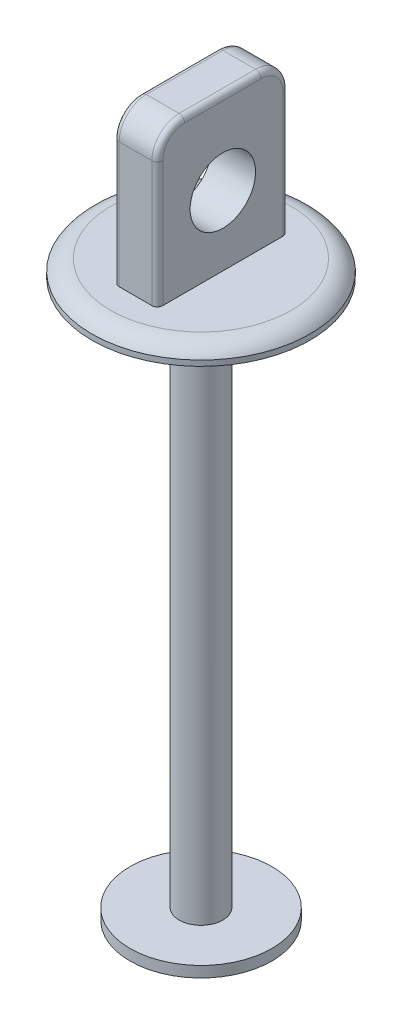
from build123d import *

# Parameters (mm, degrees)
SKETCH1_R               = 13
BOSS_EXTRUDE1_DEPTH     = 2
SKETCH2_R               = 4
BOSS_EXTRUDE2_DEPTH     = 100
SKETCH3_R               = 20
BOSS_EXTRUDE3_DEPTH     = 1
SKETCH4_R               = 17
BOSS_EXTRUDE4_DEPTH     = 1
SKETCH5_W               = 8
SKETCH5_H               = 24
BOSS_EXTRUDE5_DEPTH     = 30
SKETCH6_R               = 20
BOSS_EXTRUDE6_DEPTH     = 2
FILLET1_R               = 4
FILLET3_R               = 5
FILLET4_R               = 1
CUT_EXTRUDE1_DEPTH      = 136.97426227
CUT_EXTRUDE1_DEPTH_BACK = 136.97426227
SKETCH11_R              = 6


with BuildPart() as part:
    # Sketch1 → Boss-Extrude1 (new body)
    with BuildSketch(Plane(origin=(0, 0, 0), x_dir=(1, 0, 0), z_dir=(0, 1, 0))):
        with Locations(Location((0, 0, 0), (0, 0, 270))):
            Circle(SKETCH1_R)
    extrude(amount=BOSS_EXTRUDE1_DEPTH)

    # Sketch2 → Boss-Extrude2 (add)
    with BuildSketch(Plane(origin=(0, 2, 0), x_dir=(1, 0, 0), z_dir=(0, 1, 0))):
        with Locations(Location((0, 0, 0), (0, 0, 270))):
            Circle(SKETCH2_R)
    extrude(amount=BOSS_EXTRUDE2_DEPTH)

    # Sketch3 → Boss-Extrude3 (add)
    with BuildSketch(Plane(origin=(0, 102, 0), x_dir=(1, 0, 0), z_dir=(0, 1, 0))):
        with Locations(Location((0, 0, 0), (0, 0, 270))):
            Circle(SKETCH3_R)
    extrude(amount=BOSS_EXTRUDE3_DEPTH)

    # Sketch4 → Boss-Extrude4 (add)
    with BuildSketch(Plane.XZ.offset(-102)):
        with Locations(Location((0, 0, 0), (0, 0, 90))):
            Circle(SKETCH4_R)
    extrude(amount=BOSS_EXTRUDE4_DEPTH)

    # Sketch5 → Boss-Extrude5 (add)
    with BuildSketch(Plane(origin=(0, 103, 0), x_dir=(1, 0, 0), z_dir=(0, 1, 0))):
        Rectangle(SKETCH5_W, SKETCH5_H)
    extrude(amount=BOSS_EXTRUDE5_DEPTH)

    # Fillet3
    fillet3_edges = [part.edges().sort_by_distance(p)[0] for p in [
        (0, 133, 12),
        (0, 133, -12),
    ]]
    fillet(fillet3_edges, radius=FILLET3_R)

    # Fillet4
    fillet4_edges = [part.edges().sort_by_distance(p)[0] for p in [
        (-4, 133, 0),
        (4, 133, 0),
        (-4, 115.5, 12),
        (-4, 115.5, -12),
        (-4, 131.535533906, 10.535533906),
        (-4, 131.535533906, -10.535533906),
        (4, 115.5, -12),
        (4, 115.5, 12),
        (4, 131.535533906, 10.535533906),
        (4, 131.535533906, -10.535533906),
    ]]
    fillet(fillet4_edges, radius=FILLET4_R)

    # Sketch11 → Cut-Extrude1 (cut, two sides: drawn at the far end of the back side and taken through both)
    with BuildSketch(Plane.ZY.offset(-CUT_EXTRUDE1_DEPTH_BACK)):
        with Locations((0, 117.767190526)):
            Circle(SKETCH11_R)
    extrude(amount=CUT_EXTRUDE1_DEPTH + CUT_EXTRUDE1_DEPTH_BACK, mode=Mode.SUBTRACT)


with BuildPart() as body_2:
    # Sketch6 → Boss-Extrude6 (new body)
    with BuildSketch(Plane(origin=(0, 103, 0), x_dir=(1, 0, 0), z_dir=(0, 1, 0))):
        with Locations(Location((0, 0, 0), (0, 0, 270))):
            Circle(SKETCH6_R)
    extrude(amount=BOSS_EXTRUDE6_DEPTH)

    # Fillet1
    # the kernel refuses this fillet: 4 mm, written as the material it takes off along each edge
    with BuildSketch(Plane(origin=(0, 105, 0), x_dir=(0, 0, 1), z_dir=(-1, 0, 0))) as fillet1_piece_1:
        with BuildLine():
            CenterArc((16.535898385, -4), FILLET1_R, 30, 60)
            Line((16.535898385, 0), (16.535898385, 0.08))
            Line((16.535898385, 0.08), (20, 0.08))
            Line((20, 0.08), (20.08, 0))
            ThreePointArc((20.08, 0), (20.08, -1), (20.069282032, -1.96))
            Line((20.069282032, -1.96), (20, -2))
        make_face()
    revolve(axis=Axis((0, 105, 0), (0, 1, 0)), mode=Mode.SUBTRACT)


solid = Compound([part.part, body_2.part])
